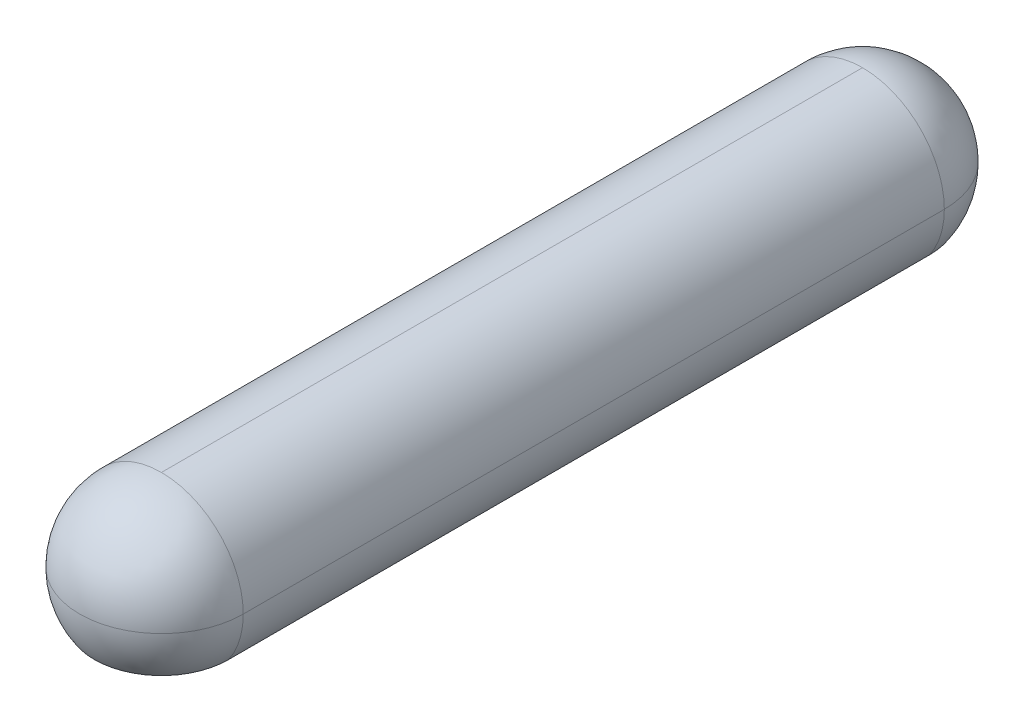
from build123d import *

# Parameters (mm, degrees)
BOSS_EXTRUDE1_DEPTH     = 14
FILLET2_R               = 7
FILLET3_R               = 7
CUT_EXTRUDE1_DEPTH      = 69.804069744
CUT_EXTRUDE1_DEPTH_BACK = 69.804069744
SKETCH2_W               = 11.489125294
SKETCH2_H               = 3
CUT_EXTRUDE2_DEPTH      = 4


with BuildPart() as part:
    # Sketch1 → Boss-Extrude1 (new body)
    with BuildSketch(Plane(origin=(0, 0, 0), x_dir=(1, 0, 0), z_dir=(0, 1, 0))):
        with BuildLine():
            Line((-7, 0), (-7, 60))
            ThreePointArc((-7, 60), (0, 67), (7, 60))
            Line((7, 60), (7, 0))
            ThreePointArc((7, 0), (0, -7), (-7, 0))
        make_face()
    extrude(amount=BOSS_EXTRUDE1_DEPTH)

    # Fillet2
    fillet2_edges = [part.edges().sort_by_distance(p)[0] for p in [
        (0, 14, -67),
        (-7, 14, -30),
        (0, 14, 7),
        (7, 14, -30),
    ]]
    fillet(fillet2_edges, radius=FILLET2_R)

    # Fillet3
    fillet3_edges = [part.edges().sort_by_distance(p)[0] for p in [
        (-7, 0, -30),
        (0, 0, 7),
        (7, 0, -30),
        (0, 0, -67),
    ]]
    fillet(fillet3_edges, radius=FILLET3_R - 0.0001)  # a hair under: the kernel refuses the full size

    # Sketch2 → Cut-Extrude1 (cut, two sides: drawn at the far end of the back side and taken through both)
    with BuildSketch(Plane(origin=(0, 0, 0), x_dir=(-1, 0, 0), z_dir=(0, 0, -1)).offset(-CUT_EXTRUDE1_DEPTH_BACK)):
        with Locations((0, 1.5)):
            Rectangle(SKETCH2_W, SKETCH2_H)
    extrude(amount=CUT_EXTRUDE1_DEPTH + CUT_EXTRUDE1_DEPTH_BACK, mode=Mode.SUBTRACT)

    # Sketch3 → Cut-Extrude2 (cut)
    with BuildSketch(Plane.XZ.offset(-3)):
        with BuildLine():
            Line((-3.75, 0), (-2.241119814, -16.932905261))
            ThreePointArc((-2.241119814, -16.932905261), (0, -18.983200531), (2.241119814, -16.932905261))
            Line((2.241119814, -16.932905261), (3.75, 0))
            ThreePointArc((3.75, 0), (0, 3.75), (-3.75, 0))
        make_face()
    extrude(amount=-CUT_EXTRUDE2_DEPTH, mode=Mode.SUBTRACT)


solid = part.part
